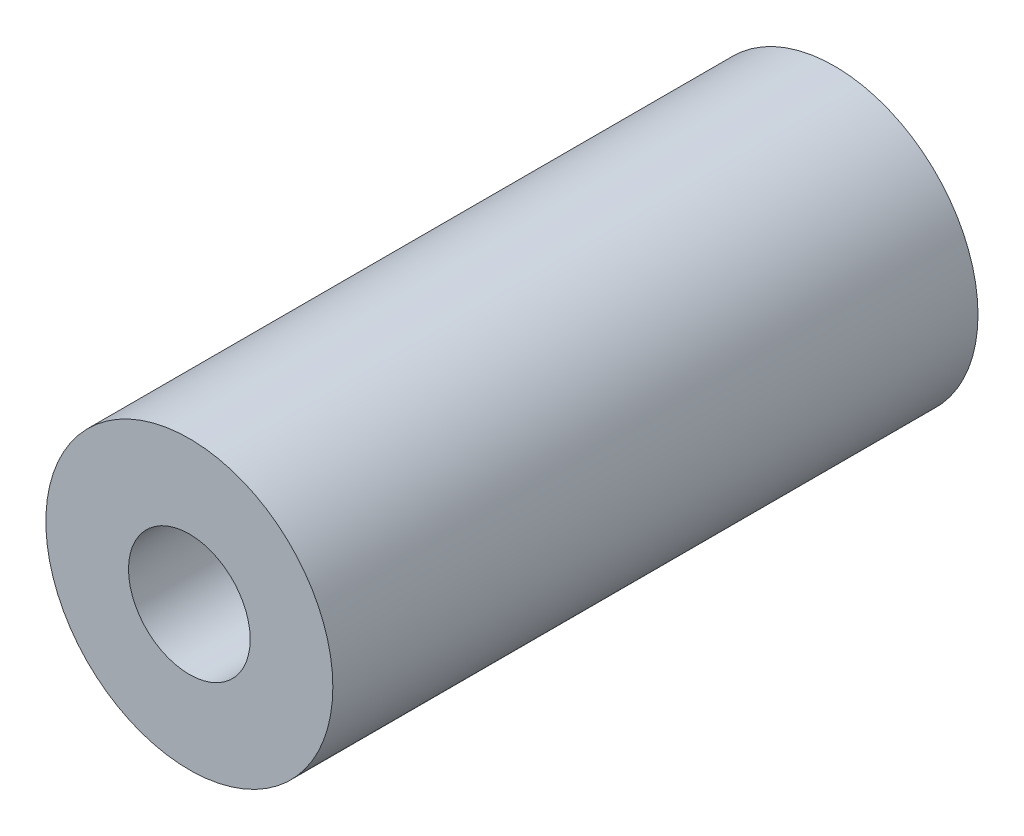
from build123d import *

# Parameters (mm, degrees)
SKETCH1_R                            = 4.7625
BOSS_EXTRUDE1_DEPTH                  = 10.7061
F_10_32_TAPPED_HOLE2_D               = 4.0386
F_10_32_TAPPED_HOLE2_DEPTH           = 15.07744
F_10_32_TAPPED_HOLE2_TIP             = 1.213317848
F_10_32_TAPPED_HOLE2_ON_FACE_2_D     = 4.0386
F_10_32_TAPPED_HOLE2_ON_FACE_2_DEPTH = 15.07744
F_10_32_TAPPED_HOLE2_ON_FACE_2_TIP   = 1.213317848


with BuildPart() as part:
    # Sketch1 → Boss-Extrude1 (new, symmetric)
    with BuildSketch(Plane.XY):
        Circle(SKETCH1_R)
    extrude(amount=BOSS_EXTRUDE1_DEPTH, both=True)

    # #10-32 Tapped Hole2
    with Locations(Plane.XY.offset(10.7061)):
        with Locations((0, 0)):
            Hole(F_10_32_TAPPED_HOLE2_D / 2, depth=F_10_32_TAPPED_HOLE2_DEPTH)
            with Locations((0, 0, -(F_10_32_TAPPED_HOLE2_DEPTH + F_10_32_TAPPED_HOLE2_TIP / 2))):  # 118° drill point
                Cone(0, F_10_32_TAPPED_HOLE2_D / 2, F_10_32_TAPPED_HOLE2_TIP, mode=Mode.SUBTRACT)

    # #10-32 Tapped Hole2 on face 2
    with Locations(Plane(origin=(0, 0, -10.7061), x_dir=(-1, 0, 0), z_dir=(0, 0, -1))):
        with Locations((0, 0)):
            Hole(F_10_32_TAPPED_HOLE2_ON_FACE_2_D / 2, depth=F_10_32_TAPPED_HOLE2_ON_FACE_2_DEPTH)
            with Locations((0, 0, -(F_10_32_TAPPED_HOLE2_ON_FACE_2_DEPTH + F_10_32_TAPPED_HOLE2_ON_FACE_2_TIP / 2))):  # 118° drill point
                Cone(0, F_10_32_TAPPED_HOLE2_ON_FACE_2_D / 2, F_10_32_TAPPED_HOLE2_ON_FACE_2_TIP, mode=Mode.SUBTRACT)


solid = part.part
